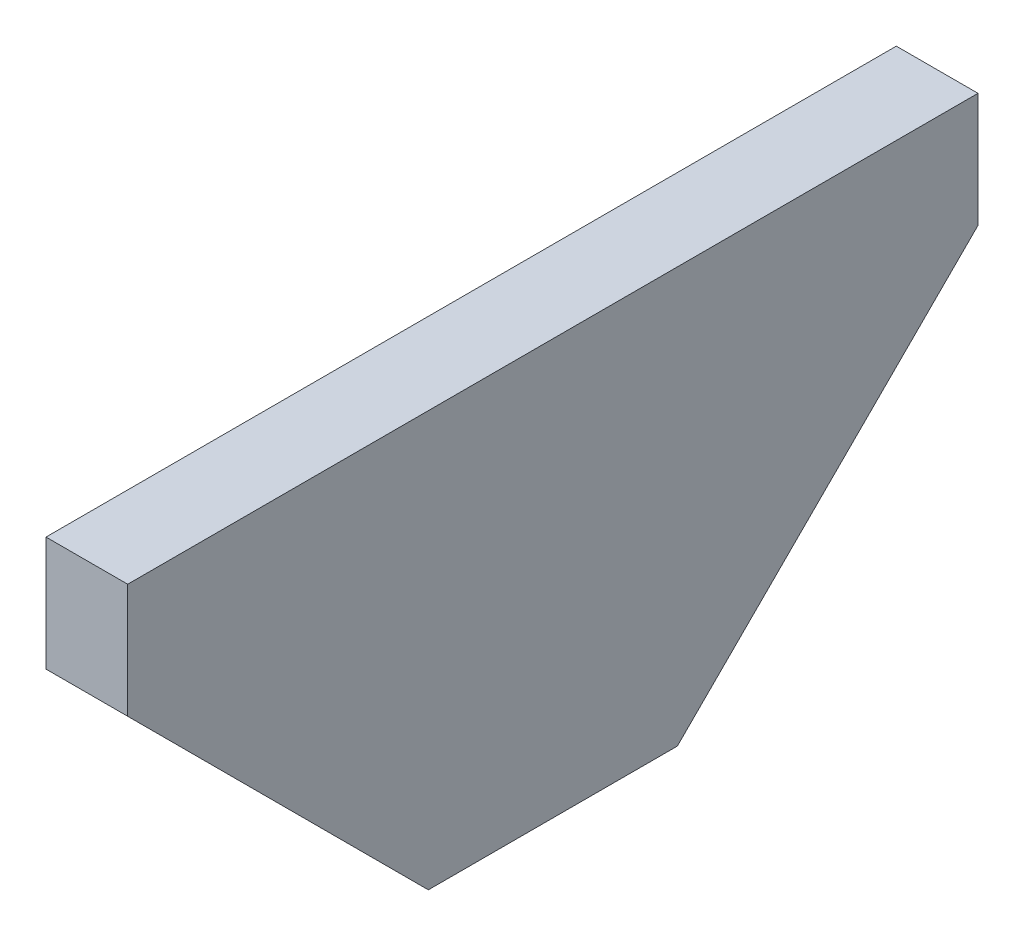
from build123d import *

# Parameters (mm, degrees)
STOCK_TEST_FINGER_MICHELLE_V2_1_START = -21.07817965
STOCK_TEST_FINGER_MICHELLE_V2_1_DEPTH = 2.5
CUT_EXTRUDE1_START                    = -1.5
SKETCH1_R                             = 1.75
CUT_EXTRUDE1_DEPTH                    = 1.5
SKETCH2_W                             = 20.99
SKETCH2_H                             = 12.7
CUT_EXTRUDE2_DEPTH                    = 23.542331171


# Read off the part's stored shape, not the designer's step: Stock-test_finger_michelle_V2-1
with BuildPart() as part:
    # Stock-test_finger_michelle_V2-1 outline → Stock-test_finger_michelle_V2-1 (new body)
    with BuildSketch(Plane.YZ.offset(STOCK_TEST_FINGER_MICHELLE_V2_1_START)):
        Polygon((0, -6.34419618), (9.2, -15.54419618), (12.7, -15.54419618), (12.7, 18.45580382), (9.2, 18.45580382), (0, 9.25580382), align=None)
    extrude(amount=STOCK_TEST_FINGER_MICHELLE_V2_1_DEPTH)

    # Sketch1 → Cut-Extrude1 (cut)
    with BuildSketch(Plane.ZY.offset(21.07817965).offset(CUT_EXTRUDE1_START)):
        with Locations(Location((-12.29419618, 9.2, 0), (0, 0, 180))):
            Circle(SKETCH1_R)
        with Locations(Location((15.20580382, 9.2, 0), (0, 0, 180))):
            Circle(SKETCH1_R)
    extrude(amount=CUT_EXTRUDE1_DEPTH, mode=Mode.SUBTRACT)

    # Sketch2 → Cut-Extrude2 (cut, through all)
    with BuildSketch(Plane.ZY.offset(21.07817965)):
        with Locations((-5.04919618, 6.35)):
            Rectangle(SKETCH2_W, SKETCH2_H)
    extrude(amount=-CUT_EXTRUDE2_DEPTH, mode=Mode.SUBTRACT)

    # Mirror1: part across plane


with BuildPart() as part_1:
    add(part.part)
    add(part.part.mirror(Plane(origin=(0, 0, 5.44580382), x_dir=(1, 0, 0), z_dir=(0, 0, -1))))


solid = part_1.part
